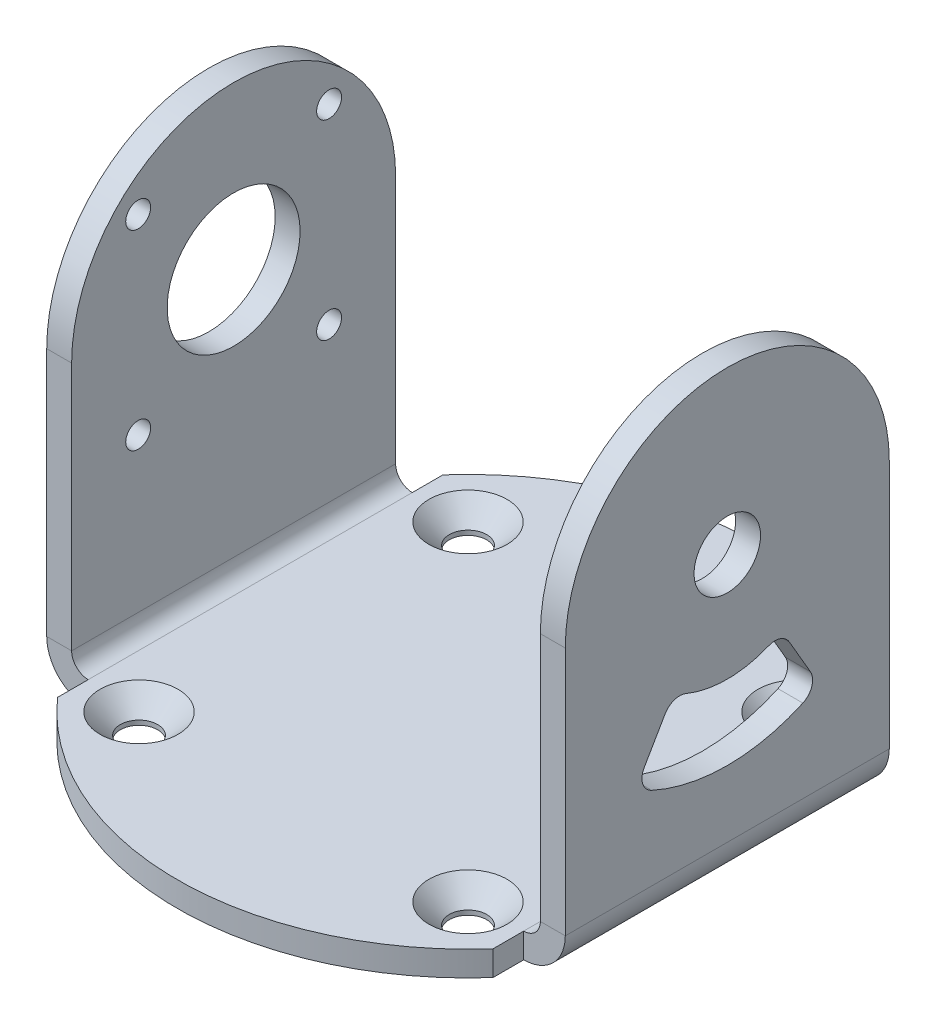
from build123d import *

# Parameters (mm, degrees)
BASE_FLANGE1_DEPTH                           = 19.5
SKETCH13_R                                   = 4
CUT_EXTRUDE6_DEPTH                           = 84.228219974
CUT_EXTRUDE7_DEPTH                           = 84.228219974
CUT_EXTRUDE7_DEPTH_BACK                      = 84.228219974
SKETCH33_R                                   = 8
CUT_EXTRUDE10_DEPTH                          = 10
SKETCH34_R                                   = 1.5
CUT_EXTRUDE11_DEPTH                          = 10
BOSS_EXTRUDE1_DEPTH                          = 3
TAB1_START                                   = -3
TAB1_DEPTH                                   = 3
CSK_FOR_M4_COUNTERSUNK_FLAT_HEAD_SCR_2_COUNT = 2
CSK_FOR_M4_COUNTERSUNK_FLAT_HEAD_SCR_2_PITCH = 39.597979746
CSK_FOR_M4_COUNTERSUNK_FLAT_HEAD_SCR_3_COUNT = 2
CSK_FOR_M4_COUNTERSUNK_FLAT_HEAD_SCR_3_PITCH = 56
CSK_FOR_M4_COUNTERSUNK_FLAT_HEAD_SCR_4_COUNT = 2
CSK_FOR_M4_COUNTERSUNK_FLAT_HEAD_SCR_4_PITCH = 39.597979746


# Read off the part's stored shape, not the designer's step: Tab1
# Sheet-metal steps are written as plain solids
with BuildPart() as part:
    # Sketch1 → Base-Flange1 (new, symmetric)
    with BuildSketch(Plane.XY):
        with BuildLine():
            Line((-28.21, 74.65), (-28.21, 2))
            ThreePointArc((-28.21, 2), (-27.624213562, 0.585786438), (-26.21, 0))
            Line((-26.21, 0), (26.21, 0))
            ThreePointArc((26.21, 0), (27.624213562, 0.585786438), (28.21, 2))
            Line((28.21, 2), (28.21, 74.65))
            Line((28.21, 74.65), (31.21, 74.65))
            Line((31.21, 74.65), (31.21, 2))
            ThreePointArc((31.21, 2), (29.745533906, -1.535533906), (26.21, -3))
            Line((26.21, -3), (-26.21, -3))
            ThreePointArc((-26.21, -3), (-29.745533906, -1.535533906), (-31.21, 2))
            Line((-31.21, 2), (-31.21, 74.65))
            Line((-31.21, 74.65), (-28.21, 74.65))
        make_face()
    extrude(amount=BASE_FLANGE1_DEPTH, both=True)

    # Sketch13 → Cut-Extrude6 (cut, through all)
    with BuildSketch(Plane(origin=(0, 0, 0), x_dir=(0, 0, -1), z_dir=(1, 0, 0))):
        with Locations((0, 32)):
            Circle(SKETCH13_R)
    extrude(amount=CUT_EXTRUDE6_DEPTH, mode=Mode.SUBTRACT)

    # Sketch15 → Cut-Extrude7 (cut, two sides: drawn at the far end of the back side and taken through both)
    with BuildSketch(Plane(origin=(0, 0, 0), x_dir=(0, 0, -1), z_dir=(1, 0, 0)).offset(-CUT_EXTRUDE7_DEPTH_BACK)):
        with BuildLine():
            Line((-19.5, 32), (-26.744382408, 32))
            Line((-26.744382408, 32), (-26.744382408, 87.632847334))
            Line((-26.744382408, 87.632847334), (26.744382408, 87.632847334))
            Line((26.744382408, 87.632847334), (26.744382408, 32))
            Line((26.744382408, 32), (19.5, 32))
            ThreePointArc((19.5, 32), (0, 51.5), (-19.5, 32))
        make_face()
        with BuildLine():
            Line((7.470480628, 19.147299148), (10, 14.795349466))
            ThreePointArc((10, 14.795349466), (10.176160856, 13.182152576), (9.097954318, 11.969342816))
            ThreePointArc((9.097954318, 11.969342816), (0, 10), (-9.097954318, 11.969342816))
            ThreePointArc((-9.097954318, 11.969342816), (-10.176160856, 13.182152576), (-10, 14.795349466))
            Line((-10, 14.795349466), (-7.470480628, 19.147299148))
            ThreePointArc((-7.470480628, 19.147299148), (-6.381394917, 20.037080634), (-4.975835097, 19.989959822))
            ThreePointArc((-4.975835097, 19.989959822), (0, 19), (4.975835097, 19.989959822))
            ThreePointArc((4.975835097, 19.989959822), (6.381394917, 20.037080634), (7.470480628, 19.147299148))
        make_face()
    extrude(amount=CUT_EXTRUDE7_DEPTH + CUT_EXTRUDE7_DEPTH_BACK, mode=Mode.SUBTRACT)

    # Sketch33 → Cut-Extrude10 (cut)
    with BuildSketch(Plane(origin=(-28.21, 0, 0), x_dir=(0, 0, -1), z_dir=(1, 0, 0))):
        with Locations((0, 32)):
            Circle(SKETCH33_R)
    extrude(amount=-CUT_EXTRUDE10_DEPTH, mode=Mode.SUBTRACT)

    # Sketch34 → Cut-Extrude11 (cut)
    with BuildSketch(Plane.ZY.offset(31.21)):
        with Locations((-11.490485194, 43.490485194)):
            Circle(SKETCH34_R)
        with Locations((11.490485194, 43.490485194)):
            Circle(SKETCH34_R)
        with Locations((11.490485194, 20.509514806)):
            Circle(SKETCH34_R)
        with Locations((-11.490485194, 20.509514806)):
            Circle(SKETCH34_R)
    extrude(amount=-CUT_EXTRUDE11_DEPTH, mode=Mode.SUBTRACT)

    # Sketch37 → Boss-Extrude1 (add)
    with BuildSketch(Plane.ZY.offset(31.21)):
        with BuildLine():
            Line((7.470480628, 19.147299148), (10, 14.795349466))
            ThreePointArc((10, 14.795349466), (10.176160856, 13.182152576), (9.097954318, 11.969342816))
            ThreePointArc((9.097954318, 11.969342816), (0, 10), (-9.097954318, 11.969342816))
            ThreePointArc((-9.097954318, 11.969342816), (-10.176160856, 13.182152576), (-10, 14.795349466))
            Line((-10, 14.795349466), (-7.470480628, 19.147299148))
            ThreePointArc((-7.470480628, 19.147299148), (-6.381394917, 20.037080634), (-4.975835097, 19.989959822))
            ThreePointArc((-4.975835097, 19.989959822), (0, 19), (4.975835097, 19.989959822))
            ThreePointArc((4.975835097, 19.989959822), (6.381394917, 20.037080634), (7.470480628, 19.147299148))
        make_face()
    extrude(amount=-BOSS_EXTRUDE1_DEPTH)

    # Tab1 outline → Tab1 (add)
    with BuildSketch(Plane.XZ.offset(3).offset(TAB1_START)):
        with BuildLine():
            Line((26.21, 19.5), (26.21, 23.195600876))
            ThreePointArc((26.21, 23.195600876), (0, 35), (-26.21, 23.195600876))
            Line((-26.21, 23.195600876), (-26.21, 19.5))
            Line((-26.21, 19.5), (26.21, 19.5))
        make_face()
        with BuildLine():
            Line((-26.21, -19.5), (-26.21, -23.195600876))
            ThreePointArc((-26.21, -23.195600876), (0, -35), (26.21, -23.195600876))
            Line((26.21, -23.195600876), (26.21, -19.5))
            Line((26.21, -19.5), (-26.21, -19.5))
        make_face()
    extrude(amount=TAB1_DEPTH)

    # Sketch42 → CSK for M4 Countersunk Flat Head Screw1 (revolve, cut)
    with BuildSketch(Plane(origin=(19.798989873, 0, -19.798989873), x_dir=(0, 0, 1), z_dir=(1, 0, 0))):
        Polygon((0, 0), (0, 3), (2.25, 3), (2.25, 2.45), (4.7, 0), align=None)
    csk_for_m4_countersunk_flat_head_screw1 = revolve(axis=Axis((19.798989873, 6.35, -19.798989873), (0, -1, 0)), mode=Mode.SUBTRACT)

    # CSK for M4 Countersunk Flat Head Scr 2: CSK for M4 Countersunk Flat Head Screw1 ×2
    with Locations(*[(-i * CSK_FOR_M4_COUNTERSUNK_FLAT_HEAD_SCR_2_PITCH, 0, 0) for i in range(1, CSK_FOR_M4_COUNTERSUNK_FLAT_HEAD_SCR_2_COUNT)]):
        add(csk_for_m4_countersunk_flat_head_screw1, mode=Mode.SUBTRACT)

    # CSK for M4 Countersunk Flat Head Scr 3: CSK for M4 Countersunk Flat Head Screw1 ×2
    with Locations(*[Vector(-0.7071067811865476, 0, 0.7071067811865476) * (i * CSK_FOR_M4_COUNTERSUNK_FLAT_HEAD_SCR_3_PITCH) for i in range(1, CSK_FOR_M4_COUNTERSUNK_FLAT_HEAD_SCR_3_COUNT)]):
        add(csk_for_m4_countersunk_flat_head_screw1, mode=Mode.SUBTRACT)

    # CSK for M4 Countersunk Flat Head Scr 4: CSK for M4 Countersunk Flat Head Screw1 ×2
    with Locations(*[(0, 0, i * CSK_FOR_M4_COUNTERSUNK_FLAT_HEAD_SCR_4_PITCH) for i in range(1, CSK_FOR_M4_COUNTERSUNK_FLAT_HEAD_SCR_4_COUNT)]):
        add(csk_for_m4_countersunk_flat_head_screw1, mode=Mode.SUBTRACT)


solid = part.part
